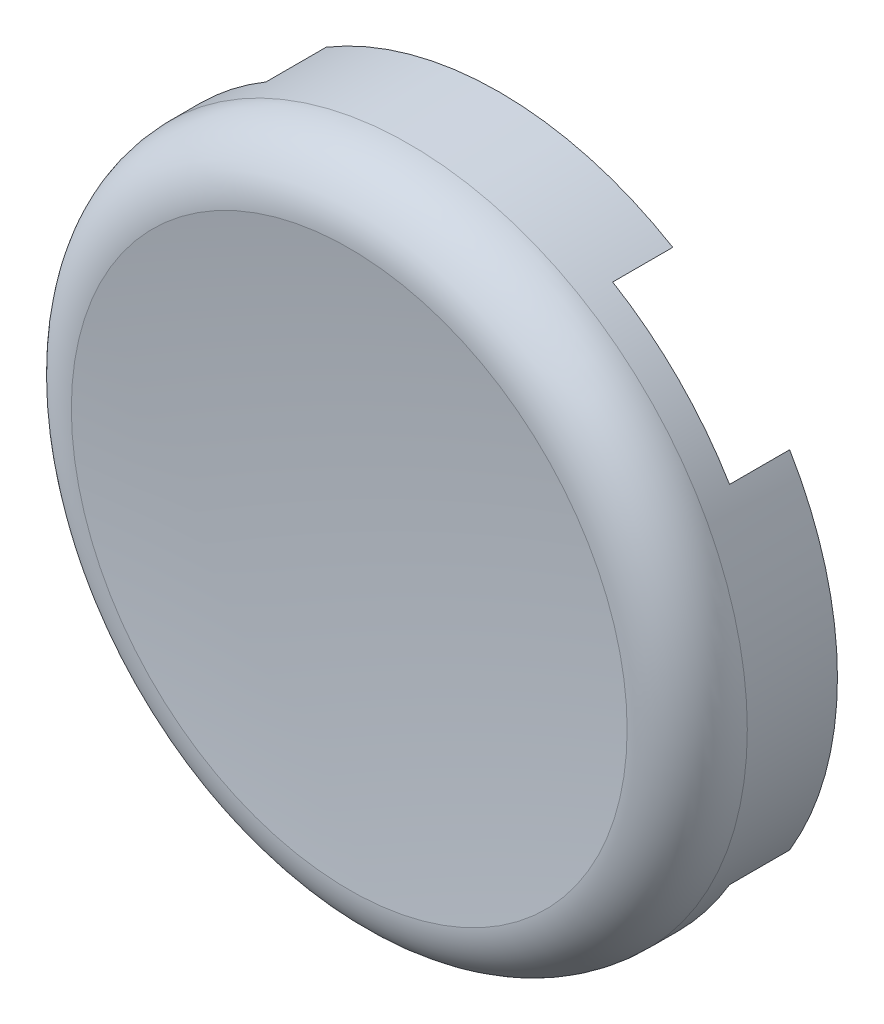
from build123d import *

# Parameters (mm, degrees)
SKETCH1_W          = 6.95
SKETCH1_H          = 0.5
SKETCH1_W_2        = 2.8
SKETCH1_H_2        = 1.2
CUT_EXTRUDE2_START = 2
CUT_EXTRUDE2_DEPTH = 2
SKETCH3_W          = 1.17
SKETCH3_H          = 1.465
SKETCH3_H_2        = 1.17
SKETCH3_W_2        = 1.465
CUT_EXTRUDE3_DEPTH = 4.3
FILLET1_R          = 0.3
FILLET2_R          = 1
FILLET3_R          = 2


with BuildPart() as part:
    # Sketch1 → Revolve1 (revolve)
    with BuildSketch(Plane(origin=(0, 0, 0), x_dir=(1, 0, 0), z_dir=(0, 1, 0)), mode=Mode.PRIVATE) as revolve1_sk:
        with BuildLine():
            Line((2.8, 0), (0, 0))
            Line((0, 0), (0, -4.5))
            ThreePointArc((0, -4.5), (4.631751828, -4.625091174), (9.25, -5))
            Line((9.25, -5), (11.25, -5))
            Line((11.25, -5), (11.25, 0))
            Line((11.25, 0), (9.75, 0))
            Line((9.75, 0), (9.75, -3.1))
            Line((9.75, -3.1), (9.75, -3.6))
            Line((9.75, -3.6), (2.8, -3.6))
            Line((2.8, -3.6), (2.8, -3.1))
            Line((2.8, -3.1), (2.8, 0))
        make_face()
        with Locations((6.275, -3.35)):
            Rectangle(SKETCH1_W, SKETCH1_H)
        with Locations((1.4, 0.6)):
            Rectangle(SKETCH1_W_2, SKETCH1_H_2)
    revolve(revolve1_sk.sketch.rotate(Axis((0, 0, 0), (0, 0, 1)), 180), axis=Axis((0, 0, 0), (0, 0, 1)))

    # Sketch2 → Cut-Extrude2 (cut)
    with BuildSketch(Plane.XY.offset(CUT_EXTRUDE2_START)):
        with BuildLine():
            Line((8.558921926, 7.350980651), (7.350980651, 8.558921926))
            Line((7.350980651, 8.558921926), (4.669834629, 8.558921926))
            ThreePointArc((4.669834629, 8.558921926), (6.894291117, 6.894291117), (8.558921926, 4.669834629))
            Line((8.558921926, 4.669834629), (8.558921926, 7.350980651))
        make_face()
        Polygon((7.350980651, 8.558921926), (6.01040764, 9.899494937), (4.669834629, 8.558921926), align=None)
        Polygon((9.899494937, 6.01040764), (8.558921926, 7.350980651), (8.558921926, 4.669834629), align=None)
        Polygon((9.899494937, -6.01040764), (8.558921926, -4.669834629), (8.558921926, -7.350980651), align=None)
        with BuildLine():
            Line((8.558921926, -7.350980651), (8.558921926, -4.669834629))
            ThreePointArc((8.558921926, -4.669834629), (6.894291117, -6.894291117), (4.669834629, -8.558921926))
            Line((4.669834629, -8.558921926), (7.350980651, -8.558921926))
            Line((7.350980651, -8.558921926), (8.558921926, -7.350980651))
        make_face()
        Polygon((7.350980651, -8.558921926), (4.669834629, -8.558921926), (6.01040764, -9.899494937), align=None)
        Polygon((-6.01040764, -9.899494937), (-4.669834629, -8.558921926), (-7.350980651, -8.558921926), align=None)
        with BuildLine():
            ThreePointArc((-4.669834629, -8.558921926), (-6.894291117, -6.894291117), (-8.558921926, -4.669834629))
            Line((-8.558921926, -4.669834629), (-8.558921926, -7.350980651))
            Line((-8.558921926, -7.350980651), (-7.350980651, -8.558921926))
            Line((-7.350980651, -8.558921926), (-4.669834629, -8.558921926))
        make_face()
        Polygon((-8.558921926, -7.350980651), (-8.558921926, -4.669834629), (-9.899494937, -6.01040764), align=None)
        Polygon((-9.899494937, 6.01040764), (-8.558921926, 4.669834629), (-8.558921926, 7.350980651), align=None)
        with BuildLine():
            ThreePointArc((-8.558921926, 4.669834629), (-6.894291117, 6.894291117), (-4.669834629, 8.558921926))
            Line((-4.669834629, 8.558921926), (-7.350980651, 8.558921926))
            Line((-7.350980651, 8.558921926), (-8.558921926, 7.350980651))
            Line((-8.558921926, 7.350980651), (-8.558921926, 4.669834629))
        make_face()
        Polygon((-7.350980651, 8.558921926), (-4.669834629, 8.558921926), (-6.01040764, 9.899494937), align=None)
    extrude(amount=-CUT_EXTRUDE2_DEPTH, mode=Mode.SUBTRACT)

    # Sketch3 → Cut-Extrude3 (cut)
    with BuildSketch(Plane(origin=(0, 0, -1.2), x_dir=(-1, 0, 0), z_dir=(0, 0, -1))):
        with Locations((0, 1.3175)):
            Rectangle(SKETCH3_W, SKETCH3_H)
        Rectangle(SKETCH3_W, SKETCH3_H_2)
        with Locations((0, -1.3175)):
            Rectangle(SKETCH3_W, SKETCH3_H)
        with Locations((-1.3175, 0)):
            Rectangle(SKETCH3_W_2, SKETCH3_H_2)
        with Locations((1.3175, 0)):
            Rectangle(SKETCH3_W_2, SKETCH3_H_2)
    extrude(amount=-CUT_EXTRUDE3_DEPTH, mode=Mode.SUBTRACT)

    # Fillet1
    fillet1_edges = [part.edges().sort_by_distance(p)[0] for p in [
        (0.585, 0.585, 0.95),
        (0.585, -0.585, 0.95),
        (-0.585, -0.585, 0.95),
        (-0.585, 0.585, 0.95),
    ]]
    fillet(fillet1_edges, radius=FILLET1_R)

    # Fillet2
    fillet2_edges = [part.edges().sort_by_distance(p)[0] for p in [
        (9.75, 0, 3.1),
    ]]
    fillet(fillet2_edges, radius=FILLET2_R)

    # Fillet3
    fillet3_edges = [part.edges().sort_by_distance(p)[0] for p in [
        (11.25, 0, 5),
    ]]
    fillet(fillet3_edges, radius=FILLET3_R - 0.0001)  # a hair under: the kernel refuses the full size


solid = part.part
